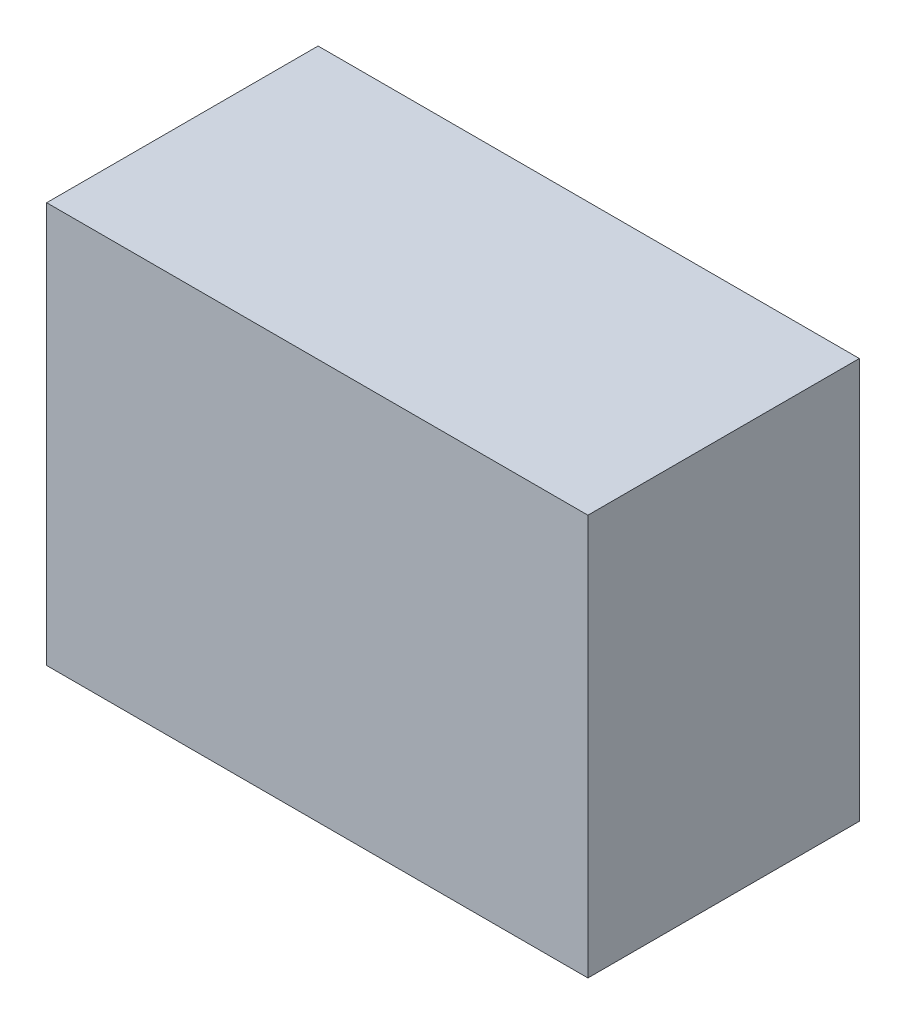
from build123d import *

# Parameters (mm, degrees)
SKETCH1_W           = 343
SKETCH1_H           = 172
BOSS_EXTRUDE1_DEPTH = 254


with BuildPart() as part:
    # Sketch1 → Boss-Extrude1 (new body)
    with BuildSketch(Plane(origin=(0, 0, 0), x_dir=(1, 0, 0), z_dir=(0, 1, 0))):
        Rectangle(SKETCH1_W, SKETCH1_H)
    extrude(amount=BOSS_EXTRUDE1_DEPTH)


solid = part.part
